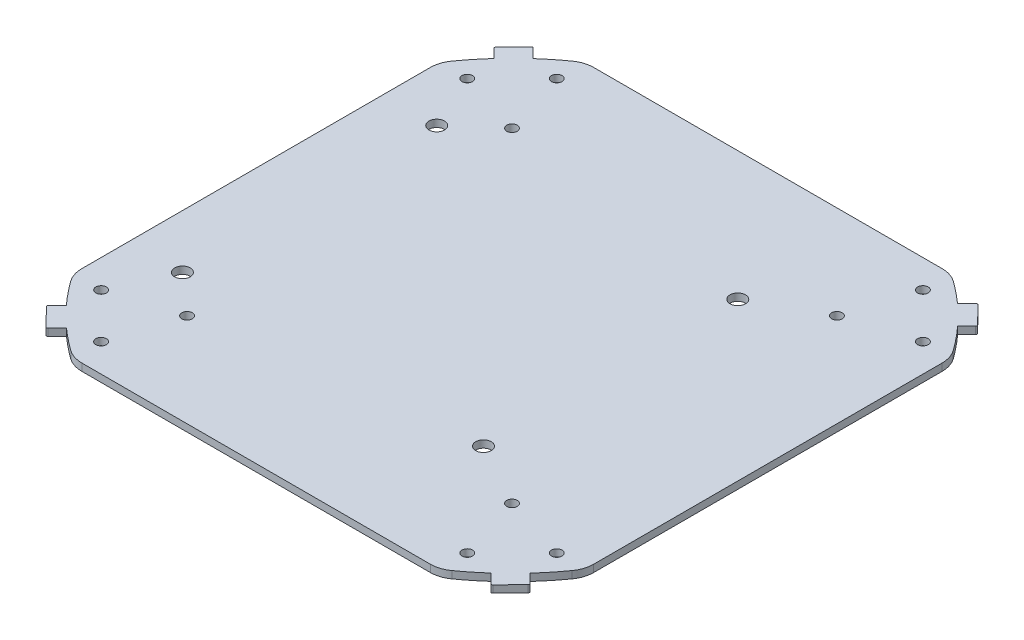
from build123d import *

# Parameters (mm, degrees)
SKETCH1_R           = 1.016000002
SKETCH1_R_2         = 1.015999994
SKETCH1_R_3         = 1.016000004
SKETCH1_R_4         = 1.016000003
SKETCH1_R_5         = 1.5
BOSS_EXTRUDE1_DEPTH = 1.397


with BuildPart() as part:
    # Sketch1 → Boss-Extrude1 (new body)
    with BuildSketch(Plane(origin=(0, 0, 0), x_dir=(1, 0, 0), z_dir=(0, 1, 0))):
        with BuildLine():
            Line((-44.657487237, -41.209177315), (-46.396043566, -42.947733643))
            ThreePointArc((-46.396043566, -42.947733643), (-46.47043426, -43.125880979), (-46.398093321, -43.304870469))
            Line((-46.398093321, -43.304870469), (-43.050556902, -46.730153436))
            ThreePointArc((-43.050556902, -46.730153436), (-42.865374913, -46.831022486), (-42.667823962, -46.757262364))
            Line((-42.667823962, -46.757262364), (-40.871772737, -44.96121114))
            ThreePointArc((-40.871772737, -44.96121114), (-38.831009329, -46.687575031), (-36.702263747, -48.304204185))
            ThreePointArc((-36.702263747, -48.304204185), (-35.216668272, -49.053976946), (-33.572746514, -49.312190732))
            Line((-33.572746514, -49.312190732), (33.572746514, -49.312190732))
            ThreePointArc((33.572746514, -49.312190732), (35.216668272, -49.053976946), (36.702263747, -48.304204185))
            ThreePointArc((36.702263747, -48.304204185), (38.831009329, -46.687575031), (40.871772737, -44.96121114))
            Line((40.871772737, -44.96121114), (42.667823962, -46.757262364))
            ThreePointArc((42.667823962, -46.757262364), (42.865374913, -46.831022486), (43.050556902, -46.730153436))
            Line((43.050556902, -46.730153436), (46.398093321, -43.304870469))
            ThreePointArc((46.398093321, -43.304870469), (46.47043426, -43.125880979), (46.396043566, -42.947733643))
            Line((46.396043566, -42.947733643), (44.657487237, -41.209177315))
            ThreePointArc((44.657487237, -41.209177315), (46.545191327, -39.007785053), (48.304204175, -36.702263762))
            ThreePointArc((48.304204175, -36.702263762), (49.053976936, -35.216668286), (49.312190722, -33.572746527))
            Line((49.312190722, -33.572746527), (49.312190722, 33.572746527))
            ThreePointArc((49.312190722, 33.572746527), (49.053976936, 35.216668286), (48.304204175, 36.702263762))
            ThreePointArc((48.304204175, 36.702263762), (46.545191327, 39.007785053), (44.657487237, 41.209177315))
            Line((44.657487237, 41.209177315), (46.396043566, 42.947733643))
            ThreePointArc((46.396043566, 42.947733643), (46.47043426, 43.125880979), (46.398093321, 43.304870469))
            Line((46.398093321, 43.304870469), (43.050556902, 46.730153436))
            ThreePointArc((43.050556902, 46.730153436), (42.865374913, 46.831022486), (42.667823962, 46.757262364))
            Line((42.667823962, 46.757262364), (40.871772737, 44.96121114))
            ThreePointArc((40.871772737, 44.96121114), (38.831009329, 46.687575031), (36.702263747, 48.304204185))
            ThreePointArc((36.702263747, 48.304204185), (35.216668272, 49.053976946), (33.572746514, 49.312190732))
            Line((33.572746514, 49.312190732), (-33.572746514, 49.312190732))
            ThreePointArc((-33.572746514, 49.312190732), (-35.216668272, 49.053976946), (-36.702263747, 48.304204185))
            ThreePointArc((-36.702263747, 48.304204185), (-38.831009329, 46.687575031), (-40.871772737, 44.96121114))
            Line((-40.871772737, 44.96121114), (-42.667823962, 46.757262364))
            ThreePointArc((-42.667823962, 46.757262364), (-42.865374913, 46.831022486), (-43.050556902, 46.730153436))
            Line((-43.050556902, 46.730153436), (-46.398093321, 43.304870469))
            ThreePointArc((-46.398093321, 43.304870469), (-46.47043426, 43.125880979), (-46.396043566, 42.947733643))
            Line((-46.396043566, 42.947733643), (-44.657487237, 41.209177315))
            ThreePointArc((-44.657487237, 41.209177315), (-46.545191327, 39.007785053), (-48.304204175, 36.702263762))
            ThreePointArc((-48.304204175, 36.702263762), (-49.053976936, 35.216668286), (-49.312190722, 33.572746527))
            Line((-49.312190722, 33.572746527), (-49.312190722, -33.572746527))
            ThreePointArc((-49.312190722, -33.572746527), (-49.053976936, -35.216668286), (-48.304204175, -36.702263762))
            ThreePointArc((-48.304204175, -36.702263762), (-46.545191327, -39.007785053), (-44.657487237, -41.209177315))
        make_face()
        with Locations((-35.273880312, -43.8949262)):
            Circle(SKETCH1_R, mode=Mode.SUBTRACT)
        with Locations((-43.89492619, -35.273880325)):
            Circle(SKETCH1_R_2, mode=Mode.SUBTRACT)
        with Locations((-31.299173987, -31.299173994)):
            Circle(SKETCH1_R, mode=Mode.SUBTRACT)
        with Locations((43.89492619, -35.273880325)):
            Circle(SKETCH1_R_3, mode=Mode.SUBTRACT)
        with Locations((35.273880312, -43.8949262)):
            Circle(SKETCH1_R_3, mode=Mode.SUBTRACT)
        with Locations((31.299173987, -31.299173994)):
            Circle(SKETCH1_R, mode=Mode.SUBTRACT)
        with Locations((-35.273880312, 43.8949262)):
            Circle(SKETCH1_R, mode=Mode.SUBTRACT)
        with Locations((-31.299173987, 31.299173994)):
            Circle(SKETCH1_R, mode=Mode.SUBTRACT)
        with Locations((-43.89492619, 35.273880325)):
            Circle(SKETCH1_R, mode=Mode.SUBTRACT)
        with Locations((43.89492619, 35.273880325)):
            Circle(SKETCH1_R_4, mode=Mode.SUBTRACT)
        with Locations((35.273880312, 43.8949262)):
            Circle(SKETCH1_R_3, mode=Mode.SUBTRACT)
        with Locations((31.299173987, 31.299173994)):
            Circle(SKETCH1_R, mode=Mode.SUBTRACT)
        with Locations((-39, 24.5)):
            Circle(SKETCH1_R_5, mode=Mode.SUBTRACT)
        with Locations((19, 24.5)):
            Circle(SKETCH1_R_5, mode=Mode.SUBTRACT)
        with Locations((19.002972949, -24.499403884)):
            Circle(SKETCH1_R_5, mode=Mode.SUBTRACT)
        with Locations((-39, -24.5)):
            Circle(SKETCH1_R_5, mode=Mode.SUBTRACT)
    extrude(amount=BOSS_EXTRUDE1_DEPTH)


solid = part.part
